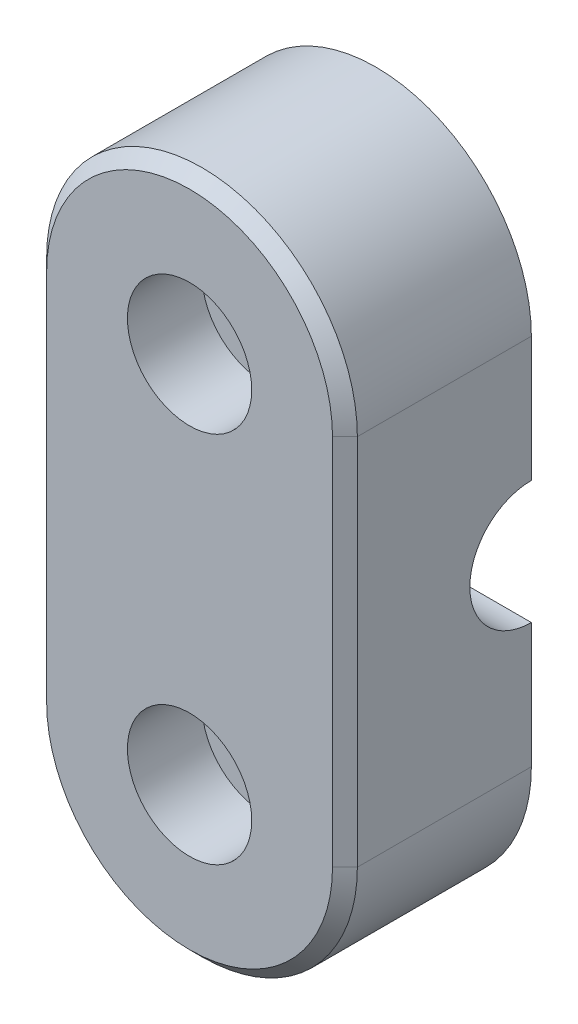
from build123d import *

# Parameters (mm, degrees)
SKETCH1_R           = 3.25
BOSS_EXTRUDE1_DEPTH = 15
CUT_EXTRUDE1_REACH  = 42.078
SKETCH2_R           = 4.95
CHAMFER1_SIZE       = 1
SKETCH3_R           = 5
CUT_EXTRUDE2_DEPTH  = 6
BOSS_EXTRUDE2_DEPTH = 0.95


with BuildPart() as part:
    # Sketch1 → Boss-Extrude1 (new body)
    with BuildSketch(Plane.XY):
        with BuildLine():
            ThreePointArc((12.5, 15), (0, 27.5), (-12.5, 15))
            Line((-12.5, 15), (-12.5, -15))
            ThreePointArc((-12.5, -15), (0, -27.5), (12.5, -15))
            Line((12.5, -15), (12.5, 15))
        make_face()
        with Locations((0, -15)):
            Circle(SKETCH1_R, mode=Mode.SUBTRACT)
        with Locations((0, 15)):
            Circle(SKETCH1_R, mode=Mode.SUBTRACT)
    extrude(amount=BOSS_EXTRUDE1_DEPTH)

    # Sketch2 → Cut-Extrude1 (cut, up to next)
    with BuildSketch(Plane(origin=(12.5, 0, 0), x_dir=(0, 0, -1), z_dir=(1, 0, 0)), mode=Mode.PRIVATE) as cut_extrude1_sk1:
        Circle(SKETCH2_R)
    cut_extrude1_tool1 = extrude(cut_extrude1_sk1.sketch, amount=-CUT_EXTRUDE1_REACH, mode=Mode.PRIVATE) & part.part
    add(cut_extrude1_tool1.solids().sort_by_distance((12.5, 0, 0))[0], mode=Mode.SUBTRACT)

    # Chamfer1
    chamfer1_edges = [part.edges().sort_by_distance(p)[0] for p in [
        (0, -27.5, 15),
        (0, 27.5, 15),
        (-12.5, 0, 15),
        (12.5, 0, 15),
    ]]
    chamfer(chamfer1_edges, length=CHAMFER1_SIZE)

    # Sketch3 → Cut-Extrude2 (cut)
    with BuildSketch(Plane.XY.offset(15)):
        with Locations((0, 15)):
            Circle(SKETCH3_R)
        with Locations((0, -15)):
            Circle(SKETCH3_R)
    extrude(amount=-CUT_EXTRUDE2_DEPTH, mode=Mode.SUBTRACT)

    # Sketch5 → Boss-Extrude2 (add, symmetric)
    with BuildSketch(Plane(origin=(0, 0, 0), x_dir=(0, 0, -1), z_dir=(1, 0, 0))):
        with BuildLine():
            Line((0, 4.5), (0, 4.95))
            ThreePointArc((0, 4.95), (-4.95, 0), (0, -4.95))
            Line((0, -4.95), (0, -4.5))
            ThreePointArc((0, -4.5), (-4.5, 0), (0, 4.5))
        make_face()
    extrude(amount=BOSS_EXTRUDE2_DEPTH, both=True)


solid = part.part
